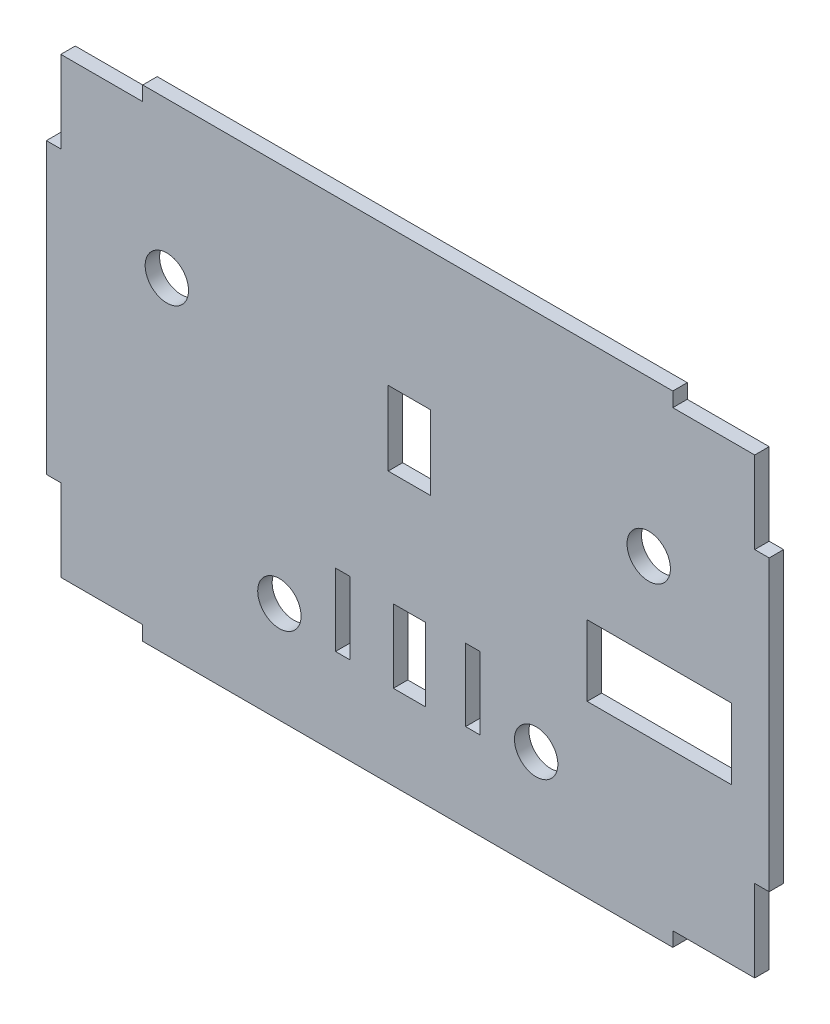
from build123d import *

# Parameters (mm, degrees)
SKETCH1_W           = 150
SKETCH1_H           = 100
BOSS_EXTRUDE1_DEPTH = 3
SKETCH2_W           = 20
SKETCH2_H           = 3
CUT_EXTRUDE1_DEPTH  = 3
SKETCH3_W           = 3
SKETCH3_H           = 17
CUT_EXTRUDE2_DEPTH  = 3
SKETCH5_R           = 4.5
CUT_EXTRUDE4_DEPTH  = 30.5
SKETCH6_R           = 4.5
CUT_EXTRUDE5_DEPTH  = 10
SKETCH7_R           = 1
CUT_EXTRUDE6_DEPTH  = 10
SKETCH9_W           = 29.951530893
SKETCH9_H           = 14.675464834
CUT_EXTRUDE7_DEPTH  = 10
SKETCH10_W          = 6.632124697
SKETCH10_H          = 15.189704953
CUT_EXTRUDE8_DEPTH  = 10
CAVITY1_START       = -15
CAVITY1_OUTLINE_W   = 15
CAVITY1_OUTLINE_H   = 3
CAVITY1_DEPTH       = 3
CAVITY1_START_2     = 12
CAVITY1_2_OUTLINE_W = 15
CAVITY1_2_OUTLINE_H = 3
CAVITY1_2_DEPTH     = 3
SKETCH11_W          = 8.771519761
SKETCH11_H          = 15.403644459
CUT_EXTRUDE9_DEPTH  = 10


# Read off the part's stored shape, not the designer's step: Cavity1
with BuildPart() as part:
    # Sketch1 → Boss-Extrude1 (new body)
    with BuildSketch(Plane.XY):
        Rectangle(SKETCH1_W, SKETCH1_H)
    extrude(amount=BOSS_EXTRUDE1_DEPTH)

    # Sketch2 → Cut-Extrude1 (cut)
    with BuildSketch(Plane.XY.offset(3)):
        with Locations((65, 48.5)):
            Rectangle(SKETCH2_W, SKETCH2_H)
        with Locations((-65, 48.5)):
            Rectangle(SKETCH2_W, SKETCH2_H)
        with Locations((-65, -48.5)):
            Rectangle(SKETCH2_W, SKETCH2_H)
        with Locations((65, -48.5)):
            Rectangle(SKETCH2_W, SKETCH2_H)
    extrude(amount=-CUT_EXTRUDE1_DEPTH, mode=Mode.SUBTRACT)

    # Sketch3 → Cut-Extrude2 (cut)
    with BuildSketch(Plane.XY.offset(3)):
        with Locations((-73.5, 38.5)):
            Rectangle(SKETCH3_W, SKETCH3_H)
        with Locations((-73.5, -38.5)):
            Rectangle(SKETCH3_W, SKETCH3_H)
        with Locations((73.5, 38.5)):
            Rectangle(SKETCH3_W, SKETCH3_H)
        with Locations((73.5, -38.5)):
            Rectangle(SKETCH3_W, SKETCH3_H)
    extrude(amount=-CUT_EXTRUDE2_DEPTH, mode=Mode.SUBTRACT)

    # Sketch5 → Cut-Extrude4 (cut)
    with BuildSketch(Plane.XY.offset(3)):
        with Locations((50, 17.807715926)):
            Circle(SKETCH5_R)
        with Locations((-50, 17.807715926)):
            Circle(SKETCH5_R)
    extrude(amount=-CUT_EXTRUDE4_DEPTH, mode=Mode.SUBTRACT)

    # Sketch6 → Cut-Extrude5 (cut)
    with BuildSketch(Plane(origin=(0, 0, 0), x_dir=(-1, 0, 0), z_dir=(0, 0, -1))):
        with Locations((26.644067797, -29.026784983)):
            Circle(SKETCH6_R)
        with Locations((-26.644067797, -29.026784983)):
            Circle(SKETCH6_R)
    extrude(amount=-CUT_EXTRUDE5_DEPTH, mode=Mode.SUBTRACT)

    # Sketch7 → Cut-Extrude6 (cut)
    with BuildSketch(Plane.XY.offset(3)):
        with Locations((0, 18.473215017)):
            Circle(SKETCH7_R)
        with Locations((0, -29.026784983)):
            Circle(SKETCH7_R)
    extrude(amount=-CUT_EXTRUDE6_DEPTH, mode=Mode.SUBTRACT)

    # Sketch9 → Cut-Extrude7 (cut)
    with BuildSketch(Plane.XY.offset(3)):
        with Locations((52.201239556, -7.337732417)):
            Rectangle(SKETCH9_W, SKETCH9_H)
    extrude(amount=-CUT_EXTRUDE7_DEPTH, mode=Mode.SUBTRACT)

    # Sketch10 → Cut-Extrude8 (cut)
    with BuildSketch(Plane.XY.offset(3)):
        with Locations((0.32090926, -24.837591387)):
            Rectangle(SKETCH10_W, SKETCH10_H)
    extrude(amount=-CUT_EXTRUDE8_DEPTH, mode=Mode.SUBTRACT)

    # Cavity1 outline → Cavity1 (cut)
    with BuildSketch(Plane.YZ.offset(CAVITY1_START)):
        with Locations((-24.318956618, 1.5)):
            Rectangle(CAVITY1_OUTLINE_W, CAVITY1_OUTLINE_H)
    extrude(amount=CAVITY1_DEPTH, mode=Mode.SUBTRACT)

    # Cavity1 2 outline → Cavity1 2 (cut)
    with BuildSketch(Plane.YZ.offset(CAVITY1_START_2)):
        with Locations((-24.318956618, 1.5)):
            Rectangle(CAVITY1_2_OUTLINE_W, CAVITY1_2_OUTLINE_H)
    extrude(amount=CAVITY1_2_DEPTH, mode=Mode.SUBTRACT)

    # Sketch11 → Cut-Extrude9 (cut)
    with BuildSketch(Plane.XY.offset(3)):
        with Locations((0.32090926, 13.778489515)):
            Rectangle(SKETCH11_W, SKETCH11_H)
    extrude(amount=-CUT_EXTRUDE9_DEPTH, mode=Mode.SUBTRACT)


solid = part.part
